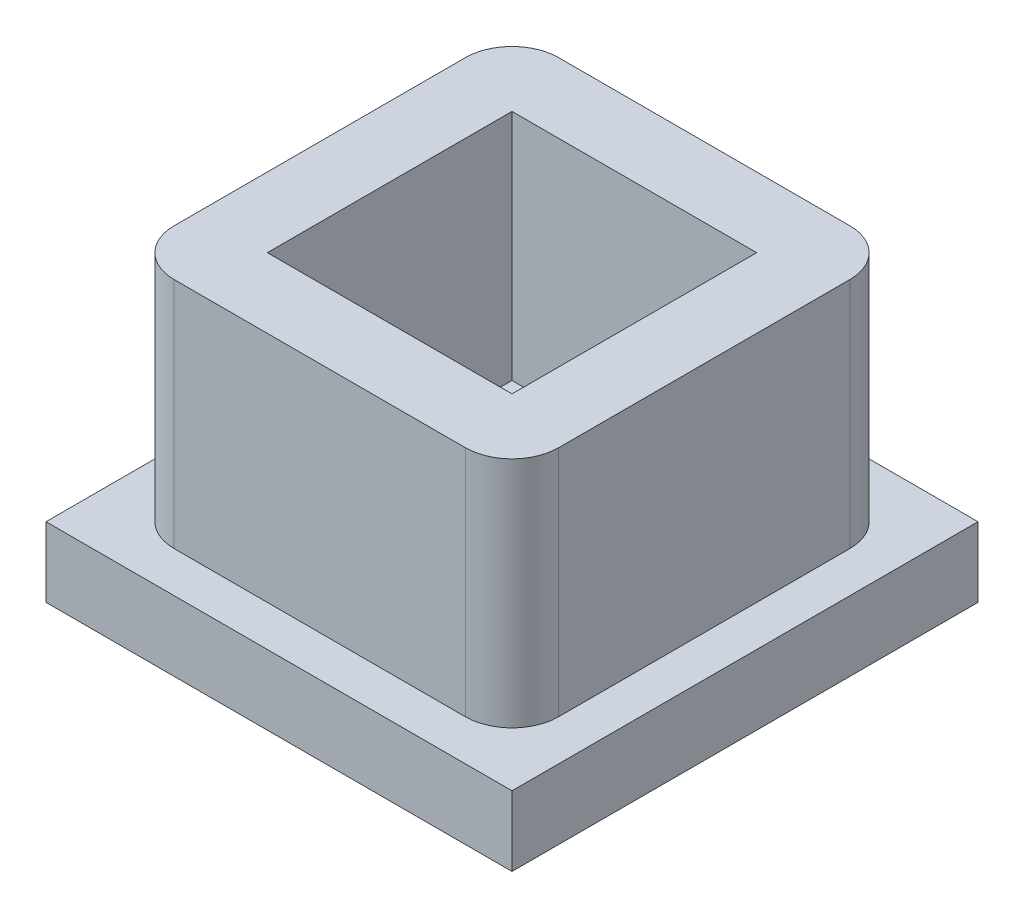
from build123d import *

# Parameters (mm, degrees)
SKETCH1_W           = 20
SKETCH1_H           = 20
BOSS_EXTRUDE1_DEPTH = 3
SKETCH2_W           = 16.5
SKETCH2_H           = 16.5
SKETCH2_W_2         = 10.5
SKETCH2_H_2         = 10.5
BOSS_EXTRUDE2_DEPTH = 10
FILLET1_R           = 2


with BuildPart() as part:
    # Sketch1 → Boss-Extrude1 (new body)
    with BuildSketch(Plane(origin=(0, 0, 0), x_dir=(1, 0, 0), z_dir=(0, 1, 0))):
        Rectangle(SKETCH1_W, SKETCH1_H)
    extrude(amount=BOSS_EXTRUDE1_DEPTH)

    # Sketch2 → Boss-Extrude2 (add)
    with BuildSketch(Plane(origin=(0, 3, 0), x_dir=(1, 0, 0), z_dir=(0, 1, 0))):
        Rectangle(SKETCH2_W, SKETCH2_H)
        Rectangle(SKETCH2_W_2, SKETCH2_H_2, mode=Mode.SUBTRACT)
    extrude(amount=BOSS_EXTRUDE2_DEPTH)

    # Fillet1
    fillet1_edges = [part.edges().sort_by_distance(p)[0] for p in [
        (-8.25, 8, 8.25),
        (8.25, 8, 8.25),
        (8.25, 8, -8.25),
        (-8.25, 8, -8.25),
    ]]
    fillet(fillet1_edges, radius=FILLET1_R)


solid = part.part
